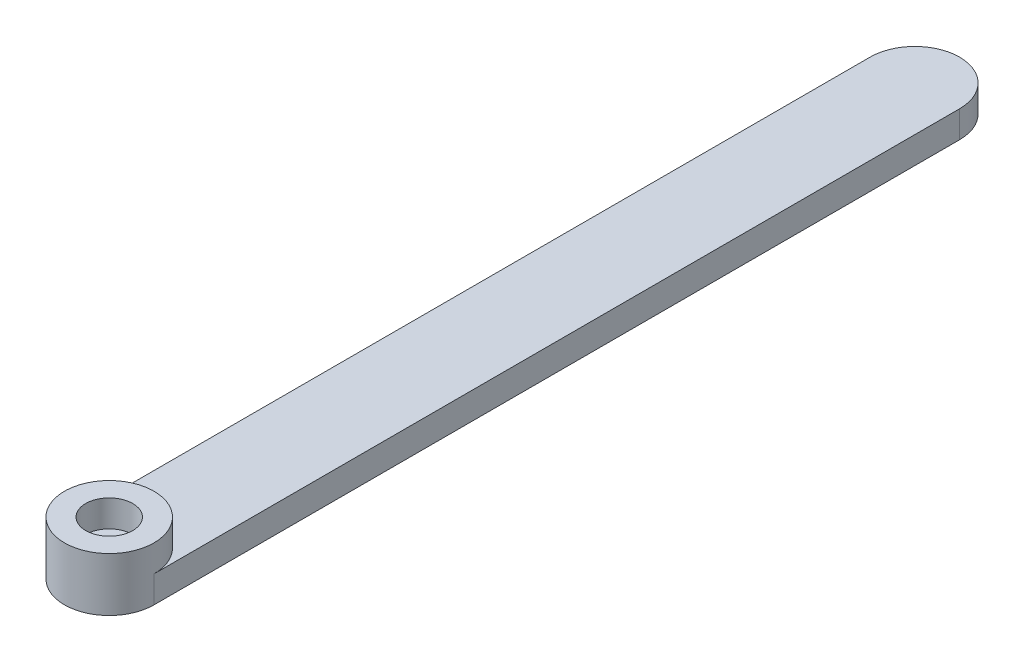
from build123d import *

# Parameters (mm, degrees)
CROQUIS1_R              = 1.15
SALIENTE_EXTRUIR1_DEPTH = 3
CROQUIS2_R              = 5
CROQUIS2_R_2            = 2.625
SALIENTE_EXTRUIR2_DEPTH = 3


with BuildPart() as part:
    # Croquis1 → Saliente-Extruir1 (new body)
    with BuildSketch(Plane(origin=(0, 0, 0), x_dir=(1, 0, 0), z_dir=(0, 1, 0))):
        with BuildLine():
            Line((-5, 0), (-5, 90))
            ThreePointArc((-5, 90), (0, 95), (5, 90))
            Line((5, 90), (5, 0))
            ThreePointArc((5, 0), (0, -5), (-5, 0))
        make_face()
        Circle(CROQUIS1_R, mode=Mode.SUBTRACT)
    extrude(amount=SALIENTE_EXTRUIR1_DEPTH)

    # Croquis2 → Saliente-Extruir2 (add)
    with BuildSketch(Plane(origin=(0, 3, 0), x_dir=(1, 0, 0), z_dir=(0, 1, 0))):
        Circle(CROQUIS2_R)
        Circle(CROQUIS2_R_2, mode=Mode.SUBTRACT)
    extrude(amount=SALIENTE_EXTRUIR2_DEPTH)


solid = part.part
